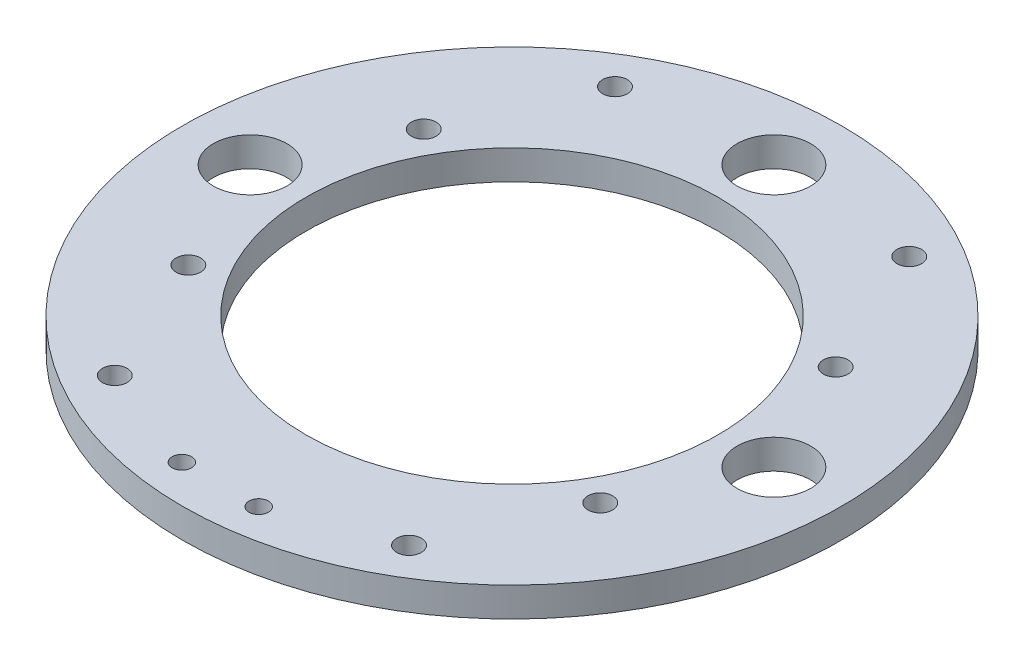
from build123d import *

# Parameters (mm, degrees)
SKETCH_1_R      = 56
SKETCH_1_R_2    = 35
SKETCH_1_R_3    = 2.1
SKETCH_1_R_4    = 1.65
SKETCH_1_R_5    = 6.25
EXTRUDE_1_DEPTH = 5


with BuildPart() as part:
    # ｽｹｯﾁ1 → ﾎﾞｽ - 押し出し1 (new body)
    with BuildSketch(Plane(origin=(0, 0, 0), x_dir=(1, 0, 0), z_dir=(0, 1, 0))):
        Circle(SKETCH_1_R)
        Circle(SKETCH_1_R_2, mode=Mode.SUBTRACT)
        with Locations((25, 42.5)):
            Circle(SKETCH_1_R_3, mode=Mode.SUBTRACT)
        with Locations((-25, 42.5)):
            Circle(SKETCH_1_R_3, mode=Mode.SUBTRACT)
        with Locations((25, -42.5)):
            Circle(SKETCH_1_R_3, mode=Mode.SUBTRACT)
        with Locations((-25, -42.5)):
            Circle(SKETCH_1_R_3, mode=Mode.SUBTRACT)
        with Locations((6.526309611, -49.572243069)):
            Circle(SKETCH_1_R_4, mode=Mode.SUBTRACT)
        with Locations((-6.526309611, -49.572243069)):
            Circle(SKETCH_1_R_4, mode=Mode.SUBTRACT)
        with Locations((35, 20)):
            Circle(SKETCH_1_R_3, mode=Mode.SUBTRACT)
        with Locations((35, -20)):
            Circle(SKETCH_1_R_3, mode=Mode.SUBTRACT)
        with Locations((-35, 20)):
            Circle(SKETCH_1_R_3, mode=Mode.SUBTRACT)
        with Locations((-35, -20)):
            Circle(SKETCH_1_R_3, mode=Mode.SUBTRACT)
        with Locations((0, 44.5)):
            Circle(SKETCH_1_R_5, mode=Mode.SUBTRACT)
        with Locations((-44.5, 0)):
            Circle(SKETCH_1_R_5, mode=Mode.SUBTRACT)
        with Locations((44.5, 0)):
            Circle(SKETCH_1_R_5, mode=Mode.SUBTRACT)
    extrude(amount=EXTRUDE_1_DEPTH)


solid = part.part
